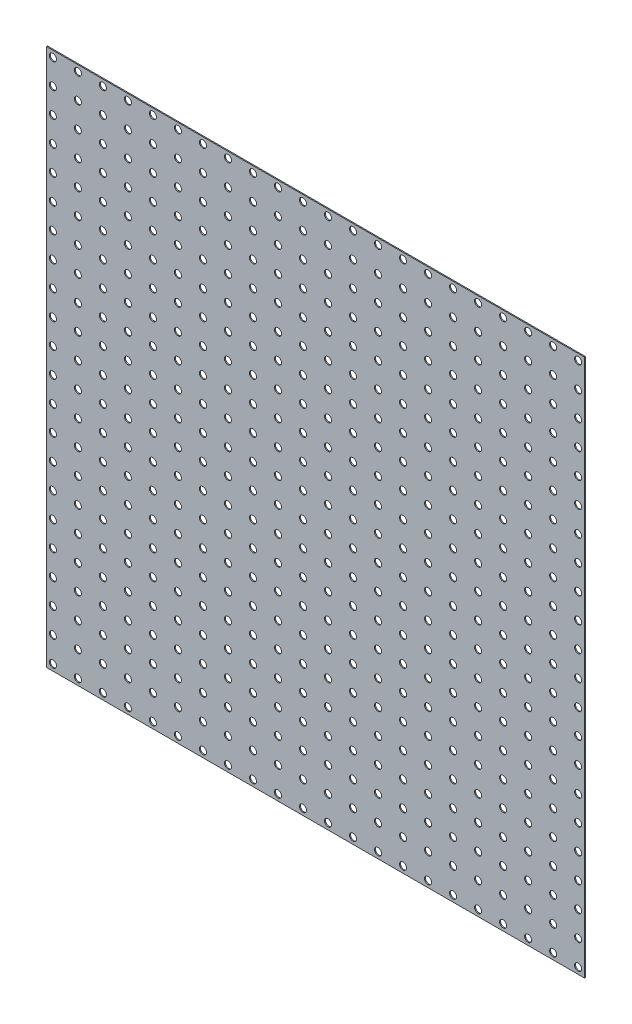
from build123d import *

# Parameters (mm, degrees)
SKETCH2_W            = 546.1
SKETCH2_H            = 546.1
BOSS_EXTRUDE1_DEPTH  = 1.016
SKETCH3_R            = 3.571875
CUT_EXTRUDE1_DEPTH   = 773.30269471
LPATTERN1_COUNT      = 11
LPATTERN1_PITCH      = 50.8
LPATTERN1_COUNT_DIR2 = 11
LPATTERN1_PITCH_DIR2 = 50.8


with BuildPart() as part:
    # Sketch2 → Boss-Extrude1 (new body)
    with BuildSketch(Plane.XY):
        with Locations((273.05, 273.05)):
            Rectangle(SKETCH2_W, SKETCH2_H)
    extrude(amount=BOSS_EXTRUDE1_DEPTH)

    # Sketch3 → Cut-Extrude1 (cut, through all)
    with BuildSketch(Plane.XY.offset(1.016)):
        with Locations((6.35, 6.35)):
            Circle(SKETCH3_R)
        with Locations((31.75, 6.35)):
            Circle(SKETCH3_R)
        with Locations((31.75, 31.75)):
            Circle(SKETCH3_R)
        with Locations((6.35, 31.75)):
            Circle(SKETCH3_R)
    cut_extrude1 = extrude(amount=-CUT_EXTRUDE1_DEPTH, mode=Mode.SUBTRACT)

    # LPattern1: Cut-Extrude1 11 × 11
    with Locations(*[(j * LPATTERN1_PITCH_DIR2, i * LPATTERN1_PITCH, 0) for i in range(LPATTERN1_COUNT) for j in range(LPATTERN1_COUNT_DIR2) if (i, j) != (0, 0)]):
        add(cut_extrude1, mode=Mode.SUBTRACT)


solid = part.part
